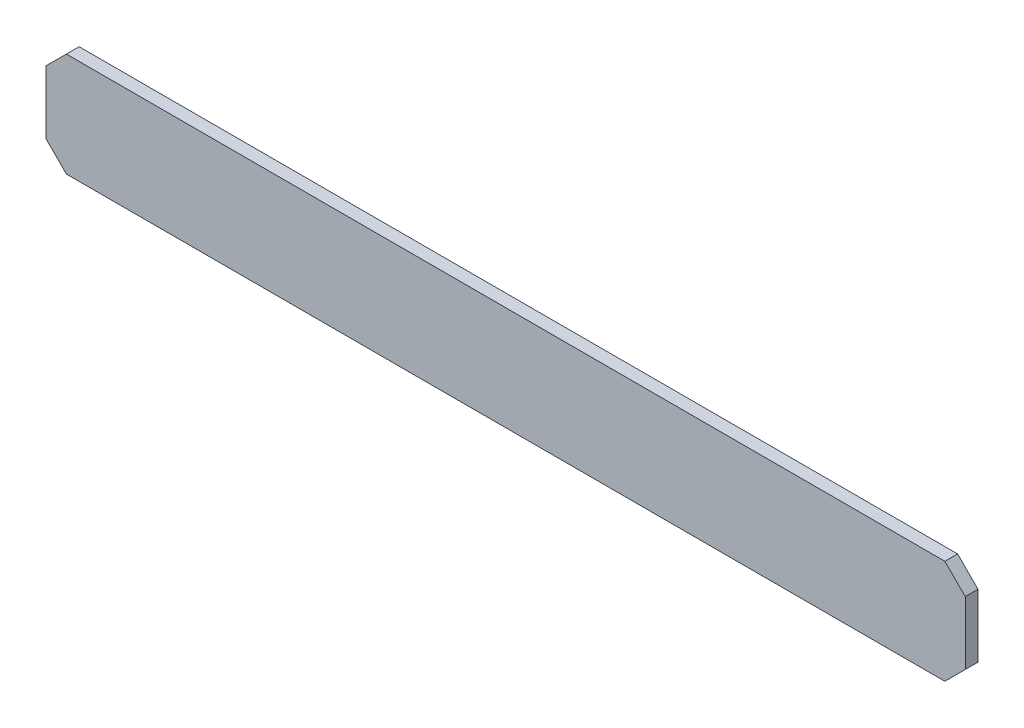
from build123d import *

# Parameters (mm, degrees)
SKETCH2_W           = 114.554000508
SKETCH2_H           = 12.954
BOSS_EXTRUDE1_DEPTH = 1.5875
CHAMFER1_SIZE       = 2.54


with BuildPart() as part:
    # Sketch2 → Boss-Extrude1 (new body)
    with BuildSketch(Plane.XY.offset(-4.7327)):
        with Locations((2.54e-07, -56.6198797)):
            Rectangle(SKETCH2_W, SKETCH2_H)
    extrude(amount=BOSS_EXTRUDE1_DEPTH)

    # Chamfer1
    chamfer1_edges = [part.edges().sort_by_distance(p)[0] for p in [
        (-57.277, -50.1428797, -3.93895),
        (-57.277, -63.0968797, -3.93895),
        (57.277000508, -50.1428797, -3.93895),
        (57.277000508, -63.0968797, -3.93895),
    ]]
    chamfer(chamfer1_edges, length=CHAMFER1_SIZE)


solid = part.part
